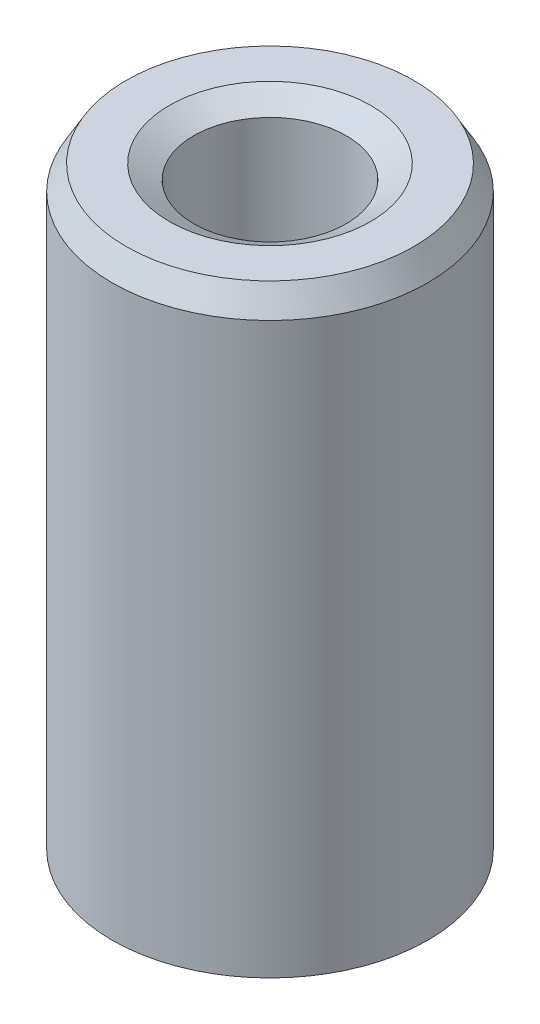
from build123d import *
from OCP.BRepFilletAPI import BRepFilletAPI_MakeChamfer

# Parameters (mm, degrees)
SKETCH1_R           = 20
BOSS_EXTRUDE1_DEPTH = 76.964750644
SKETCH2_R           = 9.663115372
CUT_EXTRUDE1_DEPTH  = 82.997395335
CHAMFER1_SIZE       = 3.083519812
CHAMFER1_SIZE2      = 1.780270993


with BuildPart() as part:
    # Sketch1 → Boss-Extrude1 (new body)
    with BuildSketch(Plane(origin=(0, 0, 0), x_dir=(1, 0, 0), z_dir=(0, 1, 0))):
        Circle(SKETCH1_R)
    extrude(amount=BOSS_EXTRUDE1_DEPTH)

    # Sketch2 → Cut-Extrude1 (cut, through all)
    with BuildSketch(Plane(origin=(0, 0, 0), x_dir=(1, 0, 0), z_dir=(0, 1, 0))):
        Circle(SKETCH2_R)
    extrude(amount=CUT_EXTRUDE1_DEPTH, mode=Mode.SUBTRACT)

    # Chamfer1: one chamfer whose edges measure the first distance from different faces: ONE call of the kernel's chamfer builder (chamfer() names one face for all edges)
    chamfer1_edges_1 = [part.edges().sort_by_distance(p)[0] for p in [
        (-9.663115372, 76.964750644, 0),
    ]]
    chamfer1_side_1 = [part.faces().sort_by_distance(p)[0] for p in [
        (-19.434314575, 76.964750644, 0),
    ]]
    chamfer1_edges_2 = [part.edges().sort_by_distance(p)[0] for p in [
        (-9.663115372, 0, 0),
    ]]
    chamfer1_side_2 = [part.faces().sort_by_distance(p)[0] for p in [
        (-9.663115372, 38.482375322, 0),
    ]]
    chamfer1_edges_3 = [part.edges().sort_by_distance(p)[0] for p in [
        (-20, 0, 0),
    ]]
    chamfer1_side_3 = [part.faces().sort_by_distance(p)[0] for p in [
        (-19.434314575, 0, 0),
    ]]
    chamfer1_edges_4 = [part.edges().sort_by_distance(p)[0] for p in [
        (-20, 76.964750644, 0),
    ]]
    chamfer1_side_4 = [part.faces().sort_by_distance(p)[0] for p in [
        (-20, 38.482375322, 0),
    ]]
    chamfer1 = BRepFilletAPI_MakeChamfer(part.part.solid().wrapped)
    for e in chamfer1_edges_1:
        chamfer1.Add(CHAMFER1_SIZE, CHAMFER1_SIZE2, e.wrapped, chamfer1_side_1[0].wrapped)  # the first distance lies on this face
    for e in chamfer1_edges_2:
        chamfer1.Add(CHAMFER1_SIZE, CHAMFER1_SIZE2, e.wrapped, chamfer1_side_2[0].wrapped)  # the first distance lies on this face
    for e in chamfer1_edges_3:
        chamfer1.Add(CHAMFER1_SIZE, CHAMFER1_SIZE2, e.wrapped, chamfer1_side_3[0].wrapped)  # the first distance lies on this face
    for e in chamfer1_edges_4:
        chamfer1.Add(CHAMFER1_SIZE, CHAMFER1_SIZE2, e.wrapped, chamfer1_side_4[0].wrapped)  # the first distance lies on this face
    add(Compound.cast(chamfer1.Shape()), mode=Mode.REPLACE)


solid = part.part
